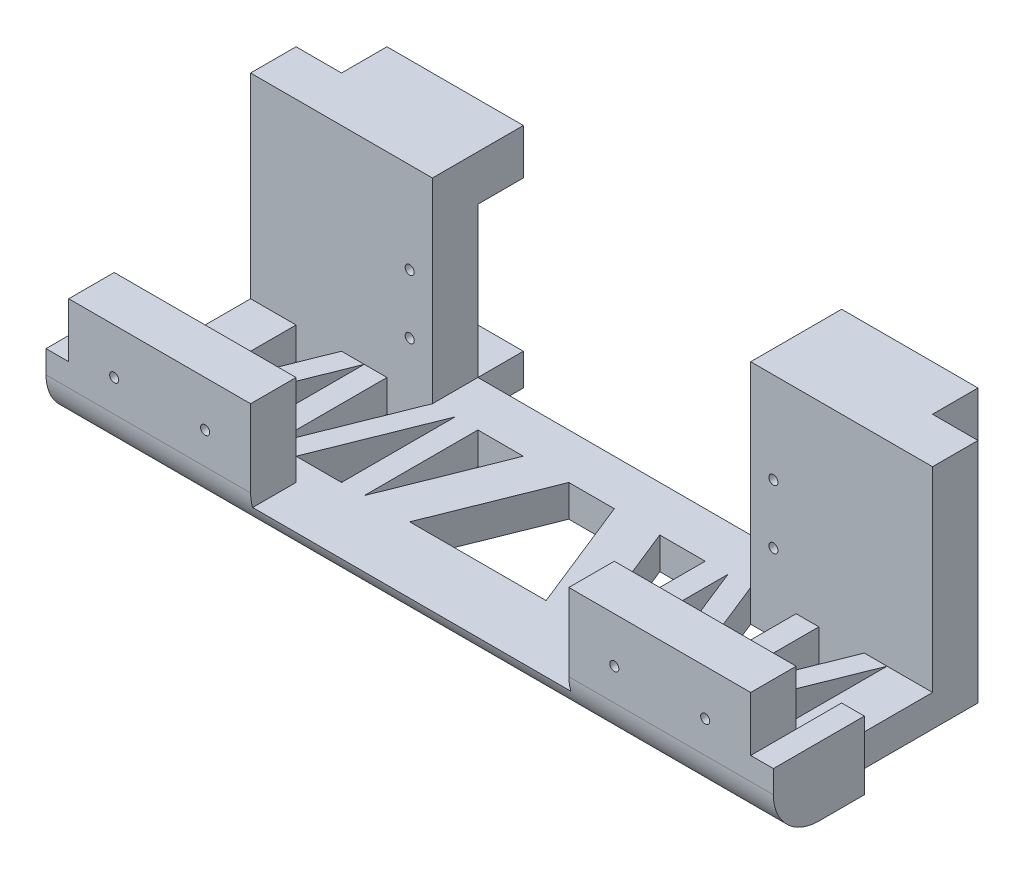
from build123d import *

# Parameters (mm, degrees)
ESQUISSE2_W             = 15
ESQUISSE2_H             = 33
ESQUISSE2_R             = 1
ESQUISSE2_W_2           = 70
ESQUISSE2_H_2           = 7
BOSS_EXTRU_1_DEPTH      = 10
ESQUISSE3_W             = 150
ESQUISSE3_H             = 7
BOSS_EXTRU_2_DEPTH      = 40
ESQUISSE4_W             = 40
ESQUISSE4_H             = 20
ESQUISSE4_R             = 1
ESQUISSE4_W_2           = 5
ESQUISSE4_H_2           = 15
BOSS_EXTRU_3_DEPTH      = 20
ENL_V_MAT_EXTRU_1_DEPTH = 181.562942337
ESQUISSE6_W             = 40
ESQUISSE6_H             = 20
ENL_V_MAT_EXTRU_2_DEPTH = 10
CONG_1_R                = 10
BOSS_EXTRU_4_DEPTH      = 10


with BuildPart() as part:
    # Esquisse2 → Boss.-Extru.1 (new body)
    # profile 1 of 5: a face of its own
    with BuildSketch(Plane.XY):
        Polygon((-121.141434162, -90.464178298), (-161.141434162, -90.464178298), (-161.141434162, -140.464178298), (-121.141434162, -140.464178298), (-121.141434162, -133.464178298), (-136.141434162, -133.464178298), (-136.141434162, -100.464178298), (-121.141434162, -100.464178298), align=None)
    # profile 2 of 5: a face of its own
    with BuildSketch(Plane.XY):
        with Locations((-128.641434162, -116.964178298)):
            Rectangle(ESQUISSE2_W, ESQUISSE2_H)
        with Locations((-126.141434162, -123.464178298)):
            Circle(ESQUISSE2_R, mode=Mode.SUBTRACT)
        with Locations((-126.141434162, -110.464178298)):
            Circle(ESQUISSE2_R, mode=Mode.SUBTRACT)
    # profile 3 of 5: a face of its own
    with BuildSketch(Plane.XY):
        with Locations((-86.141434162, -136.964178298)):
            Rectangle(ESQUISSE2_W_2, ESQUISSE2_H_2)
    # profile 4 of 5: a face of its own
    with BuildSketch(Plane.XY):
        with Locations((-43.641434162, -116.964178298)):
            Rectangle(ESQUISSE2_W, ESQUISSE2_H)
        with Locations((-46.141434162, -123.464178298)):
            Circle(ESQUISSE2_R, mode=Mode.SUBTRACT)
        with Locations((-46.141434162, -110.464178298)):
            Circle(ESQUISSE2_R, mode=Mode.SUBTRACT)
    # profile 5 of 5: a face of its own
    with BuildSketch(Plane.XY):
        Polygon((-51.141434162, -133.464178298), (-51.141434162, -140.464178298), (-11.141434162, -140.464178298), (-11.141434162, -90.464178298), (-51.141434162, -90.464178298), (-51.141434162, -100.464178298), (-36.141434162, -100.464178298), (-36.141434162, -133.464178298), align=None)
    extrude(amount=BOSS_EXTRU_1_DEPTH)

    # Esquisse3 → Boss.-Extru.2 (add)
    with BuildSketch(Plane.XY.offset(10)):
        with Locations((-86.141434162, -136.964178298)):
            Rectangle(ESQUISSE3_W, ESQUISSE3_H)
    extrude(amount=BOSS_EXTRU_2_DEPTH)

    # Esquisse4 → Boss.-Extru.3 (add)
    # profile 1 of 4: a face of its own
    with BuildSketch(Plane.XY.offset(50)):
        with Locations((-141.141434162, -123.464178298)):
            Rectangle(ESQUISSE4_W, ESQUISSE4_H)
        with Locations((-151.141434162, -123.464178298)):
            Circle(ESQUISSE4_R, mode=Mode.SUBTRACT)
        with Locations((-131.141434162, -123.464178298)):
            Circle(ESQUISSE4_R, mode=Mode.SUBTRACT)
    # profile 2 of 4: a face of its own
    with BuildSketch(Plane.XY.offset(50)):
        with Locations((-31.141434162, -123.464178298)):
            Rectangle(ESQUISSE4_W, ESQUISSE4_H)
        with Locations((-41.141434162, -123.464178298)):
            Circle(ESQUISSE4_R, mode=Mode.SUBTRACT)
        with Locations((-21.141434162, -123.464178298)):
            Circle(ESQUISSE4_R, mode=Mode.SUBTRACT)
    # profile 3 of 4: a face of its own
    with BuildSketch(Plane.XY.offset(50)):
        with Locations((-163.641434162, -132.964178298)):
            Rectangle(ESQUISSE4_W_2, ESQUISSE4_H_2)
    # profile 4 of 4: a face of its own
    with BuildSketch(Plane.XY.offset(50)):
        with Locations((-8.641434162, -132.964178298)):
            Rectangle(ESQUISSE4_W_2, ESQUISSE4_H_2)
    extrude(amount=-BOSS_EXTRU_3_DEPTH)

    # Esquisse5 → Enlèv. mat.-Extru.1 (cut, through all)
    with BuildSketch(Plane.XZ.offset(140.464178298)):
        Polygon((-151.141434162, 35), (-151.141434162, 10), (-141.141434162, 10), align=None)
        Polygon((-146.141434162, 35), (-136.141434162, 10), (-136.141434162, 35), align=None)
        Polygon((-131.141434162, 35), (-131.141434162, 10), (-121.141434162, 10), align=None)
        Polygon((-126.141434162, 35), (-116.141434162, 10), (-116.141434162, 35), align=None)
        Polygon((-101.141434162, 35), (-91.141434162, 10), (-81.141434162, 10), (-71.141434162, 35), align=None)
        Polygon((-111.141434162, 35), (-111.141434162, 10), (-101.141434162, 10), align=None)
        Polygon((-71.141434162, 10), (-61.141434162, 10), (-61.141434162, 35), align=None)
        Polygon((-46.141434162, 35), (-56.141434162, 35), (-56.141434162, 10), align=None)
        Polygon((-41.141434162, 35), (-51.141434162, 10), (-41.141434162, 10), align=None)
        Polygon((-21.141434162, 35), (-21.141434162, 10), (-31.141434162, 35), align=None)
        Polygon((-36.141434162, 35), (-36.141434162, 10), (-26.141434162, 10), align=None)
    extrude(amount=-ENL_V_MAT_EXTRU_1_DEPTH, mode=Mode.SUBTRACT)

    # Esquisse6 → Enlèv. mat.-Extru.2 (cut)
    with BuildSketch(Plane(origin=(0, 0, 30), x_dir=(-1, 0, 0), z_dir=(0, 0, -1))):
        with Locations((31.141434162, -123.464178298)):
            Rectangle(ESQUISSE6_W, ESQUISSE6_H)
        with Locations((141.141434162, -123.464178298)):
            Rectangle(ESQUISSE6_W, ESQUISSE6_H)
    extrude(amount=-ENL_V_MAT_EXTRU_2_DEPTH, mode=Mode.SUBTRACT)

    # Congé1
    # the kernel refuses this fillet: 10 mm, written as the material it takes off along each edge
    with BuildSketch(Plane(origin=(18.858565838, -140.464178298, 50), x_dir=(0, 1, 0), z_dir=(-1, 0, 0))) as cong_1_piece_1:
        with BuildLine():
            CenterArc((CONG_1_R, CONG_1_R), CONG_1_R, 180, 90)
            Line((0, CONG_1_R), (0, 0))
            Line((0, 0), (CONG_1_R, 0))
        make_face()
    extrude(amount=210, mode=Mode.SUBTRACT)

    # Esquisse7 → Boss.-Extru.4 (add)
    with BuildSketch(Plane(origin=(0, 0, 0), x_dir=(-1, 0, 0), z_dir=(0, 0, -1))):
        Polygon((51.141434162, -100.464178298), (51.141434162, -90.464178298), (21.141434162, -90.464178298), (21.141434162, -140.464178298), (51.141434162, -140.464178298), (51.141434162, -133.464178298), (36.141434162, -133.464178298), (36.141434162, -100.464178298), align=None)
        Polygon((121.141434162, -133.464178298), (121.141434162, -140.464178298), (151.141434162, -140.464178298), (151.141434162, -90.464178298), (121.141434162, -90.464178298), (121.141434162, -100.464178298), (136.141434162, -100.464178298), (136.141434162, -133.464178298), align=None)
    extrude(amount=BOSS_EXTRU_4_DEPTH)


solid = part.part
